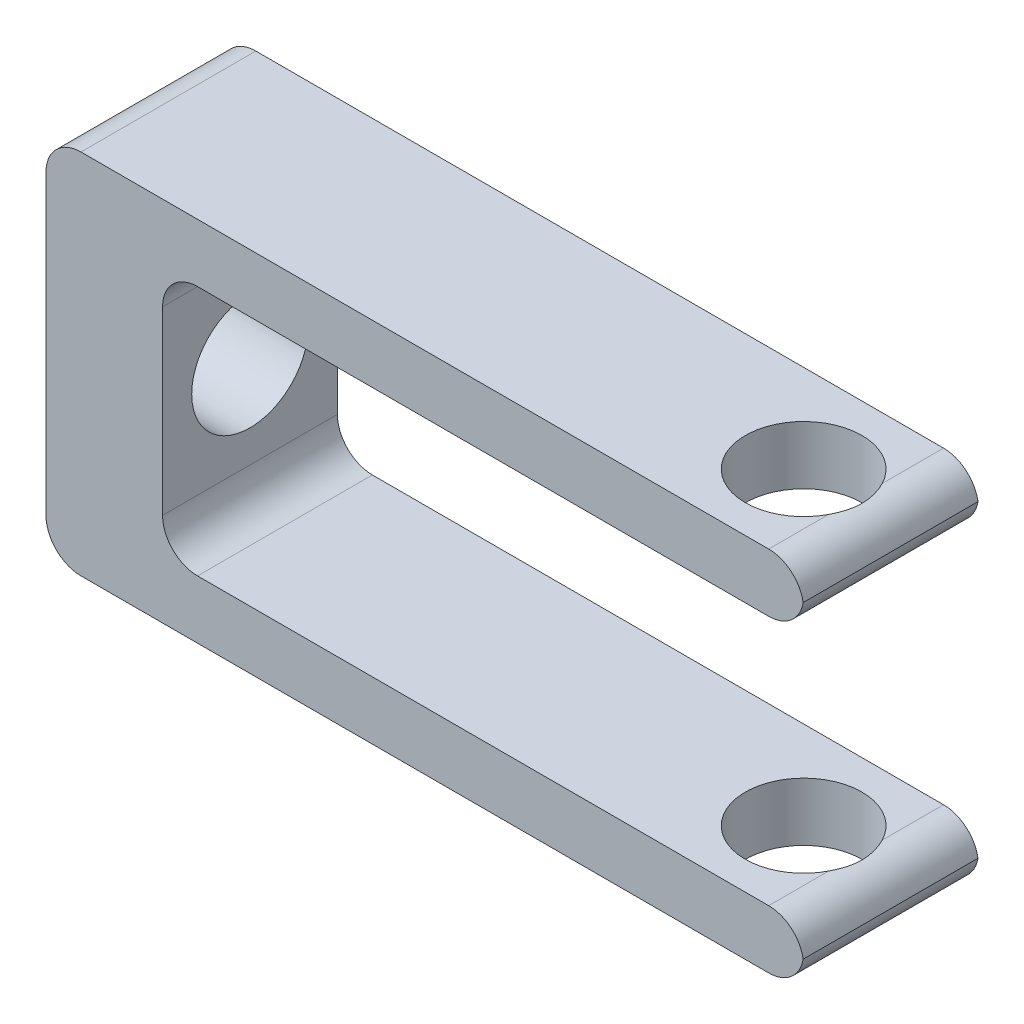
from build123d import *

# Parameters (mm, degrees)
SKETCH1_W           = 19.05
SKETCH1_H           = 40
BOSS_EXTRUDE1_DEPTH = 12.7
SKETCH2_W           = 19.05
SKETCH2_H           = 6.35
BOSS_EXTRUDE2_DEPTH = 69.85
CUT_EXTRUDE1_REACH  = 95.688
SKETCH5_R           = 6.35
SKETCH6_R           = 6.35
CUT_EXTRUDE2_DEPTH  = 94.687806037
FILLET4_R           = 3.81


with BuildPart() as part:
    # Sketch1 → Boss-Extrude1 (new body)
    with BuildSketch(Plane(origin=(0, 0, 0), x_dir=(0, 0, -1), z_dir=(1, 0, 0))):
        with Locations((9.525, 20)):
            Rectangle(SKETCH1_W, SKETCH1_H)
    extrude(amount=BOSS_EXTRUDE1_DEPTH)

    # Sketch2 → Boss-Extrude2 (add)
    with BuildSketch(Plane(origin=(12.7, 0, 0), x_dir=(0, 0, -1), z_dir=(1, 0, 0))):
        with Locations((9.525, 3.175)):
            Rectangle(SKETCH2_W, SKETCH2_H)
        with Locations((9.525, 36.825)):
            Rectangle(SKETCH2_W, SKETCH2_H)
    extrude(amount=BOSS_EXTRUDE2_DEPTH)

    # Sketch5 → Cut-Extrude1 (cut, up to next)
    with BuildSketch(Plane.ZY, mode=Mode.PRIVATE) as cut_extrude1_sk1:
        with Locations((-9.525, 20)):
            Circle(SKETCH5_R)
    cut_extrude1_tool1 = extrude(cut_extrude1_sk1.sketch, amount=-CUT_EXTRUDE1_REACH, mode=Mode.PRIVATE) & part.part
    add(cut_extrude1_tool1.solids().sort_by_distance((0, 20, -9.525))[0], mode=Mode.SUBTRACT)

    # Sketch6 → Cut-Extrude2 (cut, through all)
    with BuildSketch(Plane.XZ):
        with Locations(Location((73.1, -9.45, 0), (0, 0, 270))):
            Circle(SKETCH6_R)
    extrude(amount=-CUT_EXTRUDE2_DEPTH, mode=Mode.SUBTRACT)

    # Fillet4
    # the kernel refuses this fillet: 3.81 mm, written as the material it adds along each edge
    with BuildSketch(Plane(origin=(12.7, 33.65, 0), x_dir=(1, 0, 0), z_dir=(0, 0, -1)), Plane(origin=(12.7, 6.35, 0), x_dir=(0, 1, 0), z_dir=(0, 0, -1))) as fillet4_piece_1:
        with BuildLine():
            CenterArc((FILLET4_R, FILLET4_R), FILLET4_R, 180, 90)
            Line((0, FILLET4_R), (0, 0))
            Line((0, 0), (FILLET4_R, 0))
        make_face()
    extrude(amount=19.05)
    # the kernel refuses this fillet: 3.81 mm, written as the material it takes off along each edge
    with BuildSketch(Plane(origin=(0, 0, 9.525), x_dir=(1, 0, 0), z_dir=(0, 0, -1)), Plane(origin=(82.55, 0, -28.575), x_dir=(-1, 0, 0), z_dir=(0, 0, 1)), Plane(origin=(82.55, 33.65, 9.525), x_dir=(0, 1, 0), z_dir=(0, 0, -1))) as fillet4_2_piece_1:
        with BuildLine():
            CenterArc((FILLET4_R, -FILLET4_R), FILLET4_R, 90, 90)
            Line((0, -FILLET4_R), (0, 0))
            Line((0, 0), (FILLET4_R, 0))
        make_face()
    extrude(amount=38.1, mode=Mode.SUBTRACT)
    with BuildSketch(Plane(origin=(0, 40, -28.575), x_dir=(0, -1, 0), z_dir=(0, 0, 1)), Plane(origin=(82.55, 6.35, 9.525), x_dir=(0, -1, 0), z_dir=(0, 0, -1)), Plane(origin=(82.55, 40, -28.575), x_dir=(-1, 0, 0), z_dir=(0, 0, 1))) as fillet4_2_piece_2:
        with BuildLine():
            CenterArc((FILLET4_R, FILLET4_R), FILLET4_R, 180, 90)
            Line((0, FILLET4_R), (0, 0))
            Line((0, 0), (FILLET4_R, 0))
        make_face()
    extrude(amount=38.1, mode=Mode.SUBTRACT)


solid = part.part
